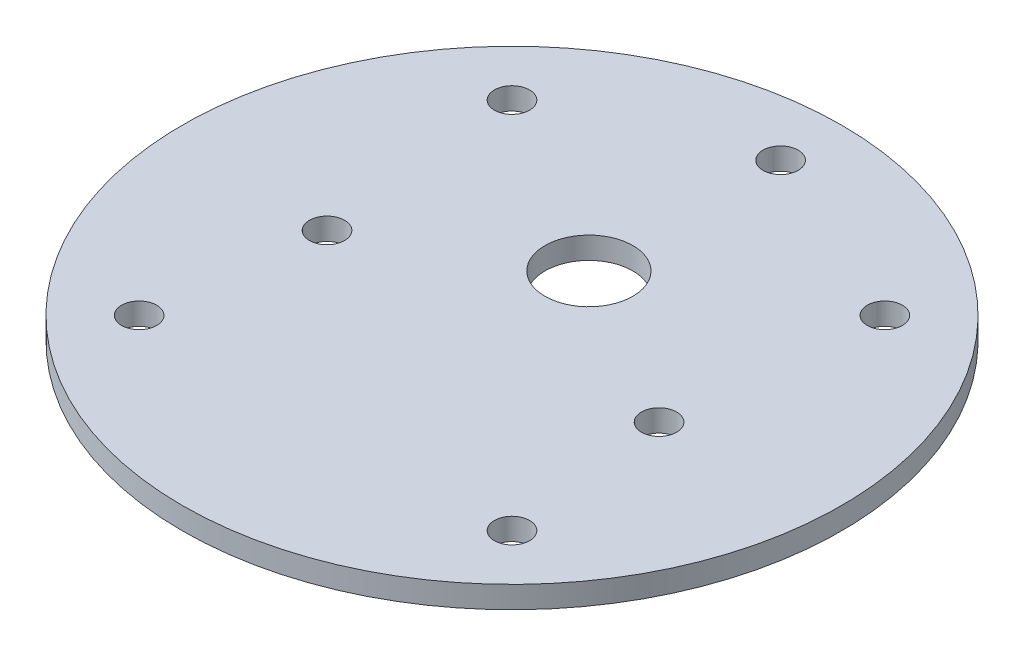
from build123d import *

# Parameters (mm, degrees)
SKETCH_1_R      = 30
SKETCH_1_R_2    = 4
SKETCH_1_R_3    = 1.6
EXTRUDE_1_DEPTH = 2


with BuildPart() as part:
    # 草图1 → 凸台-拉伸1 (new body)
    with BuildSketch(Plane(origin=(0, 0, 0), x_dir=(1, 0, 0), z_dir=(0, 1, 0))):
        Circle(SKETCH_1_R)
        with Locations((0, 7)):
            Circle(SKETCH_1_R_2, mode=Mode.SUBTRACT)
        with Locations((16.970562748, -16.970562748)):
            Circle(SKETCH_1_R_3, mode=Mode.SUBTRACT)
        with Locations((-16.970562748, -16.970562748)):
            Circle(SKETCH_1_R_3, mode=Mode.SUBTRACT)
        with Locations((-16.970562748, 16.970562748)):
            Circle(SKETCH_1_R_3, mode=Mode.SUBTRACT)
        with Locations((16.970562748, 16.970562748)):
            Circle(SKETCH_1_R_3, mode=Mode.SUBTRACT)
        with Locations((0, 24.45)):
            Circle(SKETCH_1_R_3, mode=Mode.SUBTRACT)
        with Locations((15.112143296, -1.725)):
            Circle(SKETCH_1_R_3, mode=Mode.SUBTRACT)
        with Locations((-15.112143296, -1.725)):
            Circle(SKETCH_1_R_3, mode=Mode.SUBTRACT)
    extrude(amount=EXTRUDE_1_DEPTH)


solid = part.part
